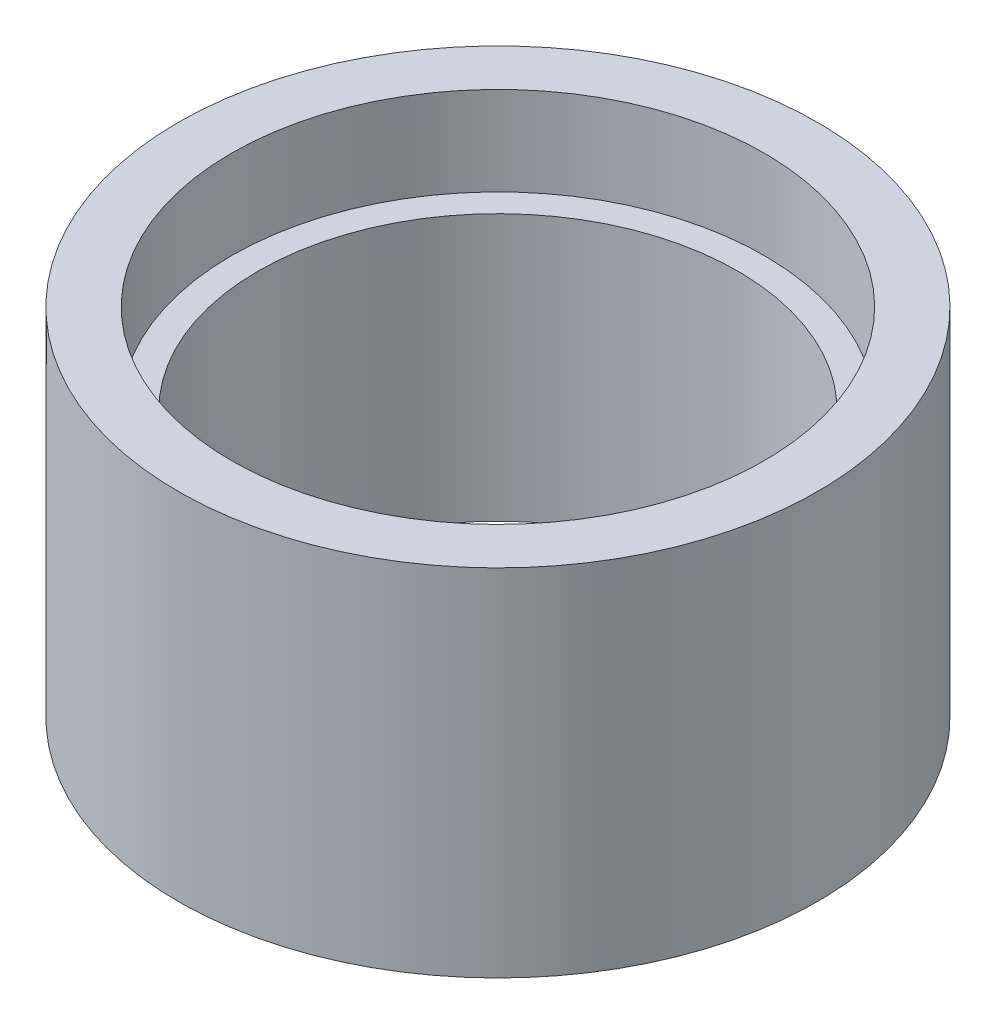
from build123d import *


with BuildPart() as part:
    # Sketch1 → Revolve1 (revolve)
    with BuildSketch(Plane.XY):
        Polygon((12, 0), (10, 0), (10, -3.3321), (9, -3.3321), (9, -13.3321), (12, -13.3321), align=None)
    revolve(axis=Axis((0, 0, 0), (0, -1, 0)))


solid = part.part
